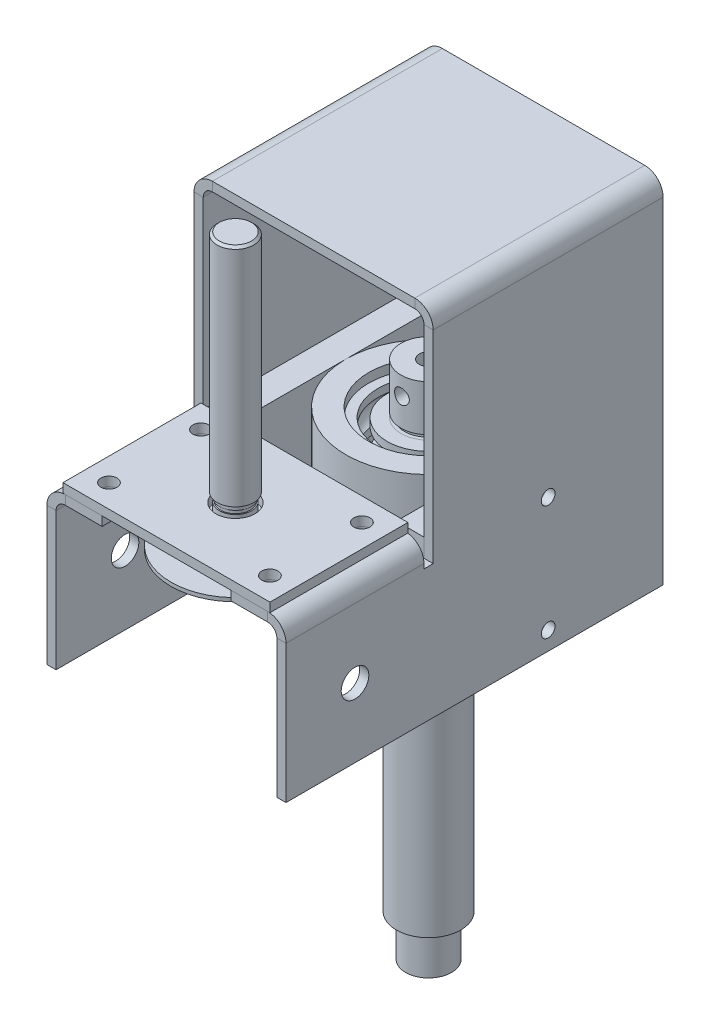
from build123d import *

# Parameters (mm, degrees)
VYSUNOUT_START                    = -25
VYSUNOUT_TENKOST_NN_1_DEPTH       = 50
VYSUNOUT1_DEPTH                   = 153.331874537
VYSUNOUT1_DEPTH_BACK              = 153.331874537
SKICA4_R                          = 1.6
LINPOLE1_COUNT                    = 2
LINPOLE1_PITCH                    = 20
SKICA8_W                          = 6
SKICA8_H                          = 50
VYSUNOUT2_DEPTH                   = 33
VYSUNOUT2_2_DEPTH                 = 33
SKICA9_R                          = 1.2
VYSUNOUT4_DEPTH                   = 159.848984888
SKICA39_R                         = 1.5
VYSUNOUT22_DEPTH                  = 159.848984888
SKICA19_W                         = 2
SKICA19_H                         = 32
VYSUNOUT7_DEPTH                   = 34
SKICA20_W                         = 10
SKICA20_H                         = 2
VYSUNOUT8_DEPTH                   = 30
OHYB_START                        = -77
OHYB_Z_HRANY5_DEPTH               = 75
OHYB_START_2                      = -2
OHYB_Z_HRANY5_2_OUTLINE_R         = 1.5
OHYB_Z_HRANY5_2_DEPTH             = 2
PROVEDEN_START                    = -25
PROVEDEN_OHYBY2_DEPTH             = 82
PROVEDEN_OHYBY2_2_DEPTH           = 50
PROVEDEN_START_2                  = 1.5000001
PROVEDEN_OHYBY2_3_OUTLINE_W       = 2
PROVEDEN_OHYBY2_3_OUTLINE_H       = 29
PROVEDEN_OHYBY2_3_DEPTH           = 55.4999999
PROVEDEN_OHYBY2_4_DEPTH           = 23.4999999
PROVEDEN_START_3                  = 27
PROVEDEN_OHYBY2_5_DEPTH           = 30
PROVEDEN_OHYBY2_6_OUTLINE_W       = 2
PROVEDEN_OHYBY2_6_OUTLINE_H       = 5
PROVEDEN_OHYBY2_6_DEPTH           = 24.4999999
PROVEDEN_START_4                  = -26
PROVEDEN_OHYBY2_7_OUTLINE_R       = 1.5
PROVEDEN_OHYBY2_7_DEPTH           = 52
PROVEDEN_OHYBY2_8_OUTLINE_W       = 35
PROVEDEN_OHYBY2_8_OUTLINE_H       = 6
PROVEDEN_OHYBY2_8_OUTLINE_R       = 1.5
PROVEDEN_OHYBY2_8_DEPTH           = 2
PROVEDEN_START_5                  = 24
PROVEDEN_OHYBY2_9_OUTLINE_W       = 35
PROVEDEN_OHYBY2_9_OUTLINE_H       = 6
PROVEDEN_OHYBY2_9_OUTLINE_R       = 1.5
PROVEDEN_OHYBY2_9_DEPTH           = 2
SKICA27_W                         = 1
SKICA27_H                         = 5
VYSUNOUT9_DEPTH                   = 167.904164118
SKICA28_W                         = 45
SKICA28_H                         = 2
VYSUNOUT10_DEPTH                  = 30
SKICA29_R                         = 1.75
SKICA29_R_2                       = 4.25
VYSUNOUT11_DEPTH                  = 124.991935222
SKICA30_R                         = 3
VYSUNOUT12_DEPTH                  = 167.904164118
VYSUNOUT13_REACH                  = 162.714
VYSUNOUT13_END_RADIUS             = 5
SKICA32_R                         = 1
VYSUNOUT13_DIRECTION_2_REACH      = 162.714
VYSUNOUT13_DIRECTION_2_END_RADIUS = 5
SKICA33_R                         = 1
VYSUNOUT14_DEPTH                  = 1
KRUHOV_POLE1_COUNT                = 4
SKICA34_R                         = 14
SKICA34_R_2                       = 3.5
SKICA34_R_3                       = 1
VYSUNOUT15_DEPTH                  = 0.8
VYSUNOUT16_DEPTH                  = 0.8


with BuildPart() as part:
    # Vysunout tenkostěnný1: read off the stored shape, not the designer's step
    # Vysunout tenkostěnný1 outline → Vysunout tenkostěnný1 (new body)
    with BuildSketch(Plane.XY.offset(VYSUNOUT_START)):
        Polygon((24, -2), (24, -77), (26, -77), (26, 0), (-26, 0), (-26, -77), (-24, -77), (-24, -2), align=None)
    extrude(amount=VYSUNOUT_TENKOST_NN_1_DEPTH)


with BuildPart() as body_2:
    # Skica3 → Rotovat1 (revolve)
    with BuildSketch(Plane.XY, mode=Mode.PRIVATE) as rotovat1_sk:
        Polygon((6, -74), (6, -46), (5.25, -46), (5.25, -45), (6, -45), (6, -35), (2, -35), (2, -50), (0, -51.154700538), (0, -133), (2.4, -134.385640646), (2.4, -148), (5, -148), (5, -139), (7, -139), (7, -74), align=None)
    revolve(rotovat1_sk.sketch.rotate(Axis((0, 0, 0), (0, -1, 0)), 90), axis=Axis((0, 0, 0), (0, -1, 0)))

    # Skica4 → Vysunout1 (cut, two sides: drawn at the far end of the back side and taken through both)
    with BuildSketch(Plane.XY.offset(-VYSUNOUT1_DEPTH_BACK)):
        with Locations((0, -39)):
            Circle(SKICA4_R)
    extrude(amount=VYSUNOUT1_DEPTH + VYSUNOUT1_DEPTH_BACK, mode=Mode.SUBTRACT)


with BuildPart() as body_3:
    # Skica5 → Rotovat2 (revolve)
    with BuildSketch(Plane.XY, mode=Mode.PRIVATE) as rotovat2_sk:
        with BuildLine():
            Line((11, -52.291287847), (11, -54))
            Line((11, -54), (14, -54))
            Line((14, -54), (14, -46))
            Line((14, -46), (11, -46))
            Line((11, -46), (11, -47.708712153))
            ThreePointArc((11, -47.708712153), (12.5, -50), (11, -52.291287847))
        make_face()
        with BuildLine():
            Line((6, -46), (6, -54))
            Line((6, -54), (9, -54))
            Line((9, -54), (9, -52.291287847))
            ThreePointArc((9, -52.291287847), (7.5, -50), (9, -47.708712153))
            Line((9, -47.708712153), (9, -46))
            Line((9, -46), (6, -46))
        make_face()
    revolve(rotovat2_sk.sketch.rotate(Axis((0, 0, 0), (0, -1, 0)), 90), axis=Axis((0, 0, 0), (0, -1, 0)))


with BuildPart() as linpole1_1:
    # LinPole1: pattern copy
    add(body_3.part.moved(Location(Vector(0, -1, 0) * (1 * LINPOLE1_PITCH))))


with BuildPart() as body_5:
    # Skica6 → Rotovat3 (revolve)
    with BuildSketch(Plane.XY, mode=Mode.PRIVATE) as rotovat3_sk:
        Polygon((14, -46), (14, -74.5), (15, -74.5), (15, -75.5), (14, -75.5), (14, -77), (18, -77), (18, -44), (13, -44), (13, -46), align=None)
    revolve(rotovat3_sk.sketch.rotate(Axis((0, 0, 0), (0, -1, 0)), 180), axis=Axis((0, 0, 0), (0, -1, 0)))


with BuildPart() as body_6:
    # Skica8 → Vysunout2 (new body)
    with BuildSketch(Plane.XZ.offset(77)):
        with Locations((-21, 0)):
            Rectangle(SKICA8_W, SKICA8_H)
    extrude(amount=-VYSUNOUT2_DEPTH)


with BuildPart() as body_7:
    # Skica8 → Vysunout2 2 (new body)
    with BuildSketch(Plane.XZ.offset(77)):
        with Locations((21, 0)):
            Rectangle(SKICA8_W, SKICA8_H)
    extrude(amount=-VYSUNOUT2_2_DEPTH)


with BuildPart() as vysunout4_tool:
    # Skica9 → Vysunout4 (new, through all)
    with BuildSketch(Plane.ZY.offset(26)):
        with Locations((0, -48)):
            Circle(SKICA9_R)
        with Locations((0, -73)):
            Circle(SKICA9_R)
    extrude(amount=-VYSUNOUT4_DEPTH)


with BuildPart() as part_1:
    add(part.part)

    # Vysunout4: cut by vysunout4_tool
    add(vysunout4_tool.part, mode=Mode.SUBTRACT)


with BuildPart() as body_7_1:
    add(body_7.part)

    # Vysunout4: cut by vysunout4_tool
    add(vysunout4_tool.part, mode=Mode.SUBTRACT)


with BuildPart() as body_6_1:
    add(body_6.part)

    # Vysunout4: cut by vysunout4_tool
    add(vysunout4_tool.part, mode=Mode.SUBTRACT)


with BuildPart() as body_5_1:
    add(body_5.part)

    # Vysunout4: cut by vysunout4_tool
    add(vysunout4_tool.part, mode=Mode.SUBTRACT)


with BuildPart() as vysunout22_tool:
    # Skica39 → Vysunout22 (new, through all)
    with BuildSketch(Plane.ZY.offset(26)):
        with Locations((0, -48)):
            Circle(SKICA39_R)
        with Locations((0, -73)):
            Circle(SKICA39_R)
    extrude(amount=-VYSUNOUT22_DEPTH)


with BuildPart() as part_2:
    add(part_1.part)

    # Vysunout22: cut by vysunout22_tool
    add(vysunout22_tool.part, mode=Mode.SUBTRACT)

    # Skica19 → Vysunout7 (add)
    with BuildSketch(Plane.XZ.offset(77)):
        with Locations((-25, 41)):
            Rectangle(SKICA19_W, SKICA19_H)
        with Locations((25, 41)):
            Rectangle(SKICA19_W, SKICA19_H)
    extrude(amount=-VYSUNOUT7_DEPTH)

    # Skica20 → Vysunout8 (add)
    with BuildSketch(Plane.XY.offset(57)):
        with Locations((-19, -44)):
            Rectangle(SKICA20_W, SKICA20_H)
        with Locations((19, -44)):
            Rectangle(SKICA20_W, SKICA20_H)
    extrude(amount=-VYSUNOUT8_DEPTH)

    # Ohyb z hrany5: read off the stored shape, not the designer's step
    # Ohyb z hrany5 outline → Ohyb z hrany5 (cut)
    with BuildSketch(Plane(origin=(0, 0, 0), x_dir=(1, 0, 0), z_dir=(0, 1, 0)).offset(OHYB_START)):
        Polygon((-24, 25), (-26, 25), (-26, -57), (-14, -57), (-14, -27), (-24, -27), align=None)
        Polygon((26, 25), (24, 25), (24, -27), (14, -27), (14, -57), (26, -57), align=None)
    extrude(amount=OHYB_Z_HRANY5_DEPTH, mode=Mode.SUBTRACT)

    # Ohyb z hrany5 2 outline → Ohyb z hrany5 2 (add)
    # profile 1 of 2: a face of its own
    with BuildSketch(Plane(origin=(0, 0, 0), x_dir=(1, 0, 0), z_dir=(0, 1, 0)).offset(OHYB_START_2)):
        Polygon((-26, 25), (-99.71238898, 25), (-99.71238898, -57), (-57, -57), (-57, -27), (-70.71238898, -27), (-70.71238898, -26), (-65.71238898, -26), (-65.71238898, -25), (-26, -25), align=None)
        with Locations((-95.71238898, 0)):
            Circle(OHYB_Z_HRANY5_2_OUTLINE_R, mode=Mode.SUBTRACT)
        with Locations((-70.71238898, 0)):
            Circle(OHYB_Z_HRANY5_2_OUTLINE_R, mode=Mode.SUBTRACT)
    # profile 2 of 2: a face of its own
    with BuildSketch(Plane(origin=(0, 0, 0), x_dir=(1, 0, 0), z_dir=(0, 1, 0)).offset(OHYB_START_2)):
        Polygon((99.71238898, 25), (26, 25), (26, -25), (65.71238898, -25), (65.71238898, -26), (70.71238898, -26), (70.71238898, -27), (57, -27), (57, -57), (99.71238898, -57), align=None)
        with Locations((70.71238898, 0)):
            Circle(OHYB_Z_HRANY5_2_OUTLINE_R, mode=Mode.SUBTRACT)
        with Locations((95.71238898, 0)):
            Circle(OHYB_Z_HRANY5_2_OUTLINE_R, mode=Mode.SUBTRACT)
    extrude(amount=OHYB_Z_HRANY5_2_DEPTH)

    # Provedené ohyby2: read off the stored shape, not the designer's step
    # Provedené ohyby2 outline → Provedené ohyby2 (cut)
    with BuildSketch(Plane.XY.offset(PROVEDEN_START)):
        with BuildLine():
            ThreePointArc((22, 0), (24, -0.535898385), (25.464101616, -2))
            Line((25.464101616, -2), (99.71238898, -2))
            Line((99.71238898, -2), (99.71238898, 0))
            Line((99.71238898, 0), (22, 0))
        make_face()
        with BuildLine():
            ThreePointArc((-25.464101616, -2), (-24, -0.535898385), (-22, 0))
            Line((-22, 0), (-99.71238898, 0))
            Line((-99.71238898, 0), (-99.71238898, -2))
            Line((-99.71238898, -2), (-25.464101616, -2))
        make_face()
    extrude(amount=PROVEDEN_OHYBY2_DEPTH, mode=Mode.SUBTRACT)

    # Proveden_ ohyby2 2 outline → Proveden_ ohyby2 2 (add)
    with BuildSketch(Plane.XY.offset(PROVEDEN_START)):
        with BuildLine():
            ThreePointArc((24, -43.535898384), (25.464101615, -45), (26, -47))
            Line((26, -47), (26, -4))
            ThreePointArc((26, -4), (25.863703305, -2.96472382), (25.464101616, -2))
            Line((25.464101616, -2), (22, -2))
            ThreePointArc((22, -2), (23.414213562, -2.585786438), (24, -4))
            Line((24, -4), (24, -43.535898384))
        make_face()
        with BuildLine():
            ThreePointArc((-26, -47), (-25.464101615, -45), (-24, -43.535898384))
            Line((-24, -43.535898384), (-24, -4))
            ThreePointArc((-24, -4), (-23.414213562, -2.585786438), (-22, -2))
            Line((-22, -2), (-25.464101616, -2))
            ThreePointArc((-25.464101616, -2), (-25.863703305, -2.96472382), (-26, -4))
            Line((-26, -4), (-26, -47))
        make_face()
    extrude(amount=PROVEDEN_OHYBY2_2_DEPTH)

    # Proveden_ ohyby2 3 outline → Proveden_ ohyby2 3 (add)
    with BuildSketch(Plane.XY.offset(PROVEDEN_START_2)):
        with Locations((25, -62.5)):
            Rectangle(PROVEDEN_OHYBY2_3_OUTLINE_W, PROVEDEN_OHYBY2_3_OUTLINE_H)
        with Locations((-25, -62.5)):
            Rectangle(PROVEDEN_OHYBY2_3_OUTLINE_W, PROVEDEN_OHYBY2_3_OUTLINE_H)
    extrude(amount=PROVEDEN_OHYBY2_3_DEPTH)

    # Proveden_ ohyby2 4 outline → Proveden_ ohyby2 4 (add)
    with BuildSketch(Plane.XY.offset(PROVEDEN_START)):
        with BuildLine():
            ThreePointArc((26, -47), (25.464101615, -45), (24, -43.535898384))
            Line((24, -43.535898384), (24, -77))
            Line((24, -77), (26, -77))
            Line((26, -77), (26, -47))
        make_face()
        with BuildLine():
            ThreePointArc((-24, -43.535898384), (-25.464101615, -45), (-26, -47))
            Line((-26, -47), (-26, -77))
            Line((-26, -77), (-24, -77))
            Line((-24, -77), (-24, -43.535898384))
        make_face()
    extrude(amount=PROVEDEN_OHYBY2_4_DEPTH)

    # Proveden_ ohyby2 5 outline → Proveden_ ohyby2 5 (add)
    with BuildSketch(Plane.XY.offset(PROVEDEN_START_3)):
        with BuildLine():
            Line((22, -43), (14, -43))
            Line((14, -43), (14, -45))
            Line((14, -45), (22, -45))
            ThreePointArc((22, -45), (23.414213562, -45.585786438), (24, -47))
            Line((24, -47), (24, -48))
            Line((24, -48), (26, -48))
            Line((26, -48), (26, -47))
            ThreePointArc((26, -47), (24.828427125, -44.171572875), (22, -43))
        make_face()
        with BuildLine():
            Line((-14, -45), (-14, -43))
            Line((-14, -43), (-22, -43))
            ThreePointArc((-22, -43), (-24.828427125, -44.171572875), (-26, -47))
            Line((-26, -47), (-26, -48))
            Line((-26, -48), (-24, -48))
            Line((-24, -48), (-24, -47))
            ThreePointArc((-24, -47), (-23.414213562, -45.585786438), (-22, -45))
            Line((-22, -45), (-14, -45))
        make_face()
    extrude(amount=PROVEDEN_OHYBY2_5_DEPTH)

    # Proveden_ ohyby2 6 outline → Proveden_ ohyby2 6 (add)
    with BuildSketch(Plane.XY.offset(PROVEDEN_START_2)):
        with Locations((25, -45.5)):
            Rectangle(PROVEDEN_OHYBY2_6_OUTLINE_W, PROVEDEN_OHYBY2_6_OUTLINE_H)
        with Locations((-25, -45.5)):
            Rectangle(PROVEDEN_OHYBY2_6_OUTLINE_W, PROVEDEN_OHYBY2_6_OUTLINE_H)
    extrude(amount=PROVEDEN_OHYBY2_6_DEPTH)

    # Proveden_ ohyby2 7 outline → Proveden_ ohyby2 7 (cut)
    with BuildSketch(Plane.YZ.offset(PROVEDEN_START_4)):
        with Locations((-48, 0)):
            Circle(PROVEDEN_OHYBY2_7_OUTLINE_R)
    extrude(amount=PROVEDEN_OHYBY2_7_DEPTH, mode=Mode.SUBTRACT)

    # Proveden_ ohyby2 8 outline → Proveden_ ohyby2 8 (add)
    with BuildSketch(Plane.YZ.offset(PROVEDEN_START_4)):
        with Locations((-59.5, 0)):
            Rectangle(PROVEDEN_OHYBY2_8_OUTLINE_W, PROVEDEN_OHYBY2_8_OUTLINE_H)
        with BuildLine():
            ThreePointArc((-48, 1.5), (-46.5, 0), (-48, -1.5))
            ThreePointArc((-48, -1.5), (-49.5, 0), (-48, 1.5))
        make_face(mode=Mode.SUBTRACT)
        with Locations((-73, 0)):
            Circle(PROVEDEN_OHYBY2_8_OUTLINE_R, mode=Mode.SUBTRACT)
    extrude(amount=PROVEDEN_OHYBY2_8_DEPTH)

    # Proveden_ ohyby2 9 outline → Proveden_ ohyby2 9 (add)
    with BuildSketch(Plane.YZ.offset(PROVEDEN_START_5)):
        with Locations((-59.5, 0)):
            Rectangle(PROVEDEN_OHYBY2_9_OUTLINE_W, PROVEDEN_OHYBY2_9_OUTLINE_H)
        with BuildLine():
            ThreePointArc((-48, 1.5), (-46.5, 0), (-48, -1.5))
            ThreePointArc((-48, -1.5), (-49.5, 0), (-48, 1.5))
        make_face(mode=Mode.SUBTRACT)
        with Locations((-73, 0)):
            Circle(PROVEDEN_OHYBY2_9_OUTLINE_R, mode=Mode.SUBTRACT)
    extrude(amount=PROVEDEN_OHYBY2_9_DEPTH)

    # Skica27 → Vysunout9 (cut, through all)
    with BuildSketch(Plane.ZY.offset(26)):
        with Locations((25.5, -45.5)):
            Rectangle(SKICA27_W, SKICA27_H)
    extrude(amount=-VYSUNOUT9_DEPTH, mode=Mode.SUBTRACT)


with BuildPart() as body_6_2:
    add(body_6_1.part)

    # Vysunout22: cut by vysunout22_tool
    add(vysunout22_tool.part, mode=Mode.SUBTRACT)


with BuildPart() as body_7_2:
    add(body_7_1.part)

    # Vysunout22: cut by vysunout22_tool
    add(vysunout22_tool.part, mode=Mode.SUBTRACT)


with BuildPart() as body_8:
    # Skica28 → Vysunout10 (new body)
    with BuildSketch(Plane.XY.offset(57)):
        with Locations((0, -42)):
            Rectangle(SKICA28_W, SKICA28_H)
    extrude(amount=-VYSUNOUT10_DEPTH)


with BuildPart() as vysunout11_tool:
    # Skica29 → Vysunout11 (new, through all)
    with BuildSketch(Plane(origin=(0, -41, 0), x_dir=(1, 0, 0), z_dir=(0, 1, 0))):
        with Locations(Location((-17.5, -32, 0), (0, 0, 180))):
            Circle(SKICA29_R)
        with Locations((17.5, -32)):
            Circle(SKICA29_R)
        with Locations(Location((17.5, -52, 0), (0, 0, 180))):
            Circle(SKICA29_R)
        with Locations((-17.5, -52)):
            Circle(SKICA29_R)
        with Locations(Location((0, -42, 0), (0, 0, 180))):
            Circle(SKICA29_R_2)
    extrude(amount=-VYSUNOUT11_DEPTH)


with BuildPart() as part_3:
    add(part_2.part)

    # Vysunout11: cut by vysunout11_tool
    add(vysunout11_tool.part, mode=Mode.SUBTRACT)

    # Skica30 → Vysunout12 (cut, through all)
    with BuildSketch(Plane.ZY.offset(26)):
        with Locations((42, -62)):
            Circle(SKICA30_R)
    extrude(amount=-VYSUNOUT12_DEPTH, mode=Mode.SUBTRACT)


with BuildPart() as body_8_1:
    add(body_8.part)

    # Vysunout11: cut by vysunout11_tool
    add(vysunout11_tool.part, mode=Mode.SUBTRACT)


with BuildPart() as body_9:
    # Skica11 → Rotovat4 (revolve)
    with BuildSketch(Plane(origin=(0, 0, 0), x_dir=(0, 0, -1), z_dir=(1, 0, 0))):
        Polygon((-38.5, -39), (-38.5, -40), (-38.75, -40), (-38.75, -40.8), (-38.5, -40.8), (-38.5, -48.8), (-38.7, -49), (-42, -49), (-42, 10), (-38.5, 10), (-38, 9.5), (-38, -39), align=None)
    revolve(axis=Axis((0, -43.581232623, 42), (0, 1, 0)))


with BuildPart() as body_10:
    # Skica31 → Rotovat5 (revolve)
    with BuildSketch(Plane(origin=(0, 0, 0), x_dir=(0, 0, -1), z_dir=(1, 0, 0)), mode=Mode.PRIVATE) as rotovat5_sk:
        Polygon((-38.5, -49), (-33, -49), (-33, -48), (-37, -48), (-37, -43), (-38.5, -43), align=None)
    revolve(rotovat5_sk.sketch.rotate(Axis((0, -48.875440522, 42), (0, -1, 0)), 180), axis=Axis((0, -48.875440522, 42), (0, -1, 0)))


with BuildPart() as vysunout13_tool:
    # Vysunout13: up to this cylinder (the profile starts inside it)
    vysunout13_end = Plane(origin=(0, -45.5, 42), z_dir=(0, 1, 0)) * Cylinder(VYSUNOUT13_END_RADIUS, 336.428, mode=Mode.PRIVATE)
    # Skica32 → Vysunout13 (new, up to the surface)
    with BuildSketch(Plane(origin=(0, 0, 0), x_dir=(0, 0, -1), z_dir=(1, 0, 0)), mode=Mode.PRIVATE) as vysunout13_sk1:
        with Locations((-42, -45.5)):
            Circle(SKICA32_R)
    vysunout13_tool1 = extrude(vysunout13_sk1.sketch, amount=-VYSUNOUT13_REACH, mode=Mode.PRIVATE) & vysunout13_end
    add(vysunout13_tool1.solids().sort_by_distance((0, -45.5, 42))[0])


with BuildPart() as body_9_1:
    add(body_9.part)

    # Vysunout13: cut by vysunout13_tool
    add(vysunout13_tool.part, mode=Mode.SUBTRACT)


with BuildPart() as body_10_1:
    add(body_10.part)

    # Vysunout13: cut by vysunout13_tool
    add(vysunout13_tool.part, mode=Mode.SUBTRACT)


with BuildPart() as vysunout13_direction_2_tool:
    # Vysunout13 direction 2: up to this cylinder (the profile starts inside it)
    vysunout13_direction_2_end = Plane(origin=(0, -45.5, 42), z_dir=(0, 1, 0)) * Cylinder(VYSUNOUT13_DIRECTION_2_END_RADIUS, 336.428, mode=Mode.PRIVATE)
    # Skica32 → Vysunout13 direction 2 (new, up to the surface)
    with BuildSketch(Plane(origin=(0, 0, 0), x_dir=(0, 0, -1), z_dir=(1, 0, 0)), mode=Mode.PRIVATE) as vysunout13_direction_2_sk1:
        with Locations((-42, -45.5)):
            Circle(SKICA32_R)
    vysunout13_direction_2_tool1 = extrude(vysunout13_direction_2_sk1.sketch, amount=VYSUNOUT13_DIRECTION_2_REACH, mode=Mode.PRIVATE) & vysunout13_direction_2_end
    add(vysunout13_direction_2_tool1.solids().sort_by_distance((0, -45.5, 42))[0])


with BuildPart() as body_9_2:
    add(body_9_1.part)

    # Vysunout13 direction 2: cut by vysunout13_direction_2_tool
    add(vysunout13_direction_2_tool.part, mode=Mode.SUBTRACT)


with BuildPart() as body_10_2:
    add(body_10_1.part)

    # Vysunout13 direction 2: cut by vysunout13_direction_2_tool
    add(vysunout13_direction_2_tool.part, mode=Mode.SUBTRACT)

    # Skica33 → Vysunout14 (cut)
    with BuildSketch(Plane.XZ.offset(49)):
        with Locations(Location((4.949747468, 46.949747468, 0), (0, 0, 270))):
            Circle(SKICA33_R)
    vysunout14 = extrude(amount=-VYSUNOUT14_DEPTH, mode=Mode.SUBTRACT)

    # Kruhové pole1: Vysunout14 ×4 about axis
    kruhov_pole1_axis = Axis((0, 0, 42), (0, 1, 0))
    for i in range(1, KRUHOV_POLE1_COUNT):
        add(vysunout14.rotate(kruhov_pole1_axis, i * 360 / KRUHOV_POLE1_COUNT), mode=Mode.SUBTRACT)


with BuildPart() as body_11:
    # Skica34 → Vysunout15 (new body)
    with BuildSketch(Plane.XZ.offset(49)):
        with Locations(Location((0, 42, 0), (0, 0, 270))):
            Circle(SKICA34_R)
        with Locations(Location((0, 42, 0), (0, 0, 270))):
            Circle(SKICA34_R_2, mode=Mode.SUBTRACT)
        with Locations(Location((-4.949747468, 37.050252532, 0), (0, 0, 270))):
            Circle(SKICA34_R_3, mode=Mode.SUBTRACT)
        with Locations(Location((4.949747468, 37.050252532, 0), (0, 0, 270))):
            Circle(SKICA34_R_3, mode=Mode.SUBTRACT)
        with Locations(Location((4.949747468, 46.949747468, 0), (0, 0, 270))):
            Circle(SKICA34_R_3, mode=Mode.SUBTRACT)
        with Locations(Location((-4.949747468, 46.949747468, 0), (0, 0, 270))):
            Circle(SKICA34_R_3, mode=Mode.SUBTRACT)
    extrude(amount=VYSUNOUT15_DEPTH)

    # Skica35 → Vysunout16 (cut)
    with BuildSketch(Plane.XZ.offset(49.8)):
        with BuildLine():
            Line((-13.999910714, 41.95), (13.999910714, 41.95))
            ThreePointArc((13.999910714, 41.95), (14, 42), (13.999910714, 42.05))
            Line((13.999910714, 42.05), (-13.999910714, 42.05))
            ThreePointArc((-13.999910714, 42.05), (-14, 42), (-13.999910714, 41.95))
        make_face()
    extrude(amount=-VYSUNOUT16_DEPTH, mode=Mode.SUBTRACT)


with BuildPart() as vysunout16_piece_1:
    # of the separate pieces the step leaves, piece 1, a body of its own (vysunout16_pieces)
    add(body_11.part.solids().sort_by_distance((13.999910714, -49, 42.05))[0])


with BuildPart() as vysunout16_piece_2:
    # of the separate pieces the step leaves, piece 2, a body of its own (vysunout16_pieces)
    add(body_11.part.solids().sort_by_distance((-13.999910714, -49, 41.95))[0])


solid = Compound([body_2.part, body_3.part, linpole1_1.part, body_5_1.part, body_6_2.part, body_7_2.part, part_3.part, body_8_1.part, body_9_2.part, body_10_2.part, vysunout16_piece_1.part, vysunout16_piece_2.part])
